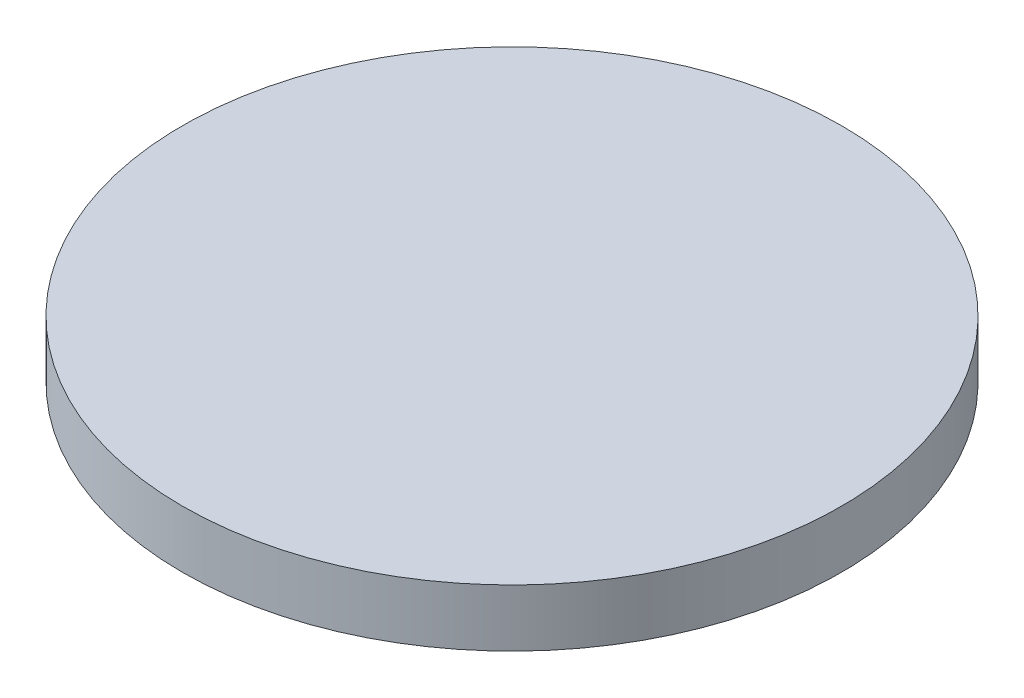
from build123d import *

# Parameters (mm, degrees)
SKETCH_1_R      = 23
EXTRUDE_1_DEPTH = 4


with BuildPart() as part:
    # Эскиз1 → Бобышка-Вытянуть1 (new body)
    with BuildSketch(Plane(origin=(0, 0, 0), x_dir=(1, 0, 0), z_dir=(0, 1, 0))):
        Circle(SKETCH_1_R)
    extrude(amount=EXTRUDE_1_DEPTH)


solid = part.part
